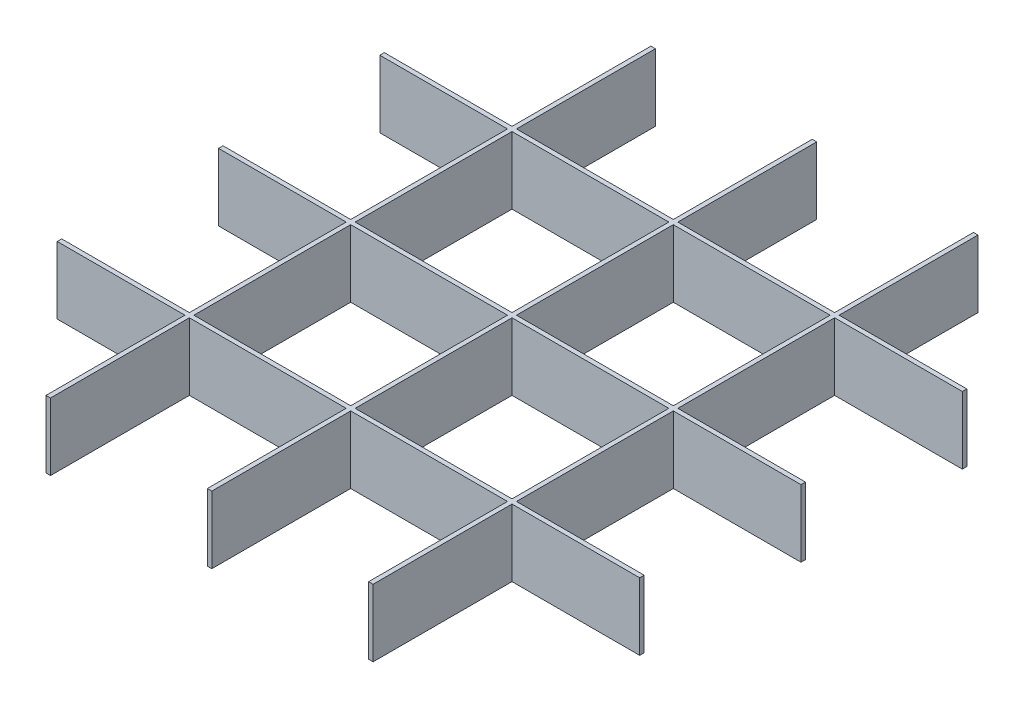
from build123d import *

# Parameters (mm, degrees)
SKETCH_1_W      = 70
SKETCH_1_H      = 70
EXTRUDE_2_DEPTH = 30


with BuildPart() as part:
    # 草图1 → 凸台-拉伸2 (new body)
    with BuildSketch(Plane(origin=(0, 0, 0), x_dir=(1, 0, 0), z_dir=(0, 1, 0))):
        Polygon((-71, 73), (-1, 73), (-1, 135), (1, 135), (1, 73), (71, 73), (71, 135), (73, 135), (73, 73), (130, 73), (130, 71), (73, 71), (73, 1), (130, 1), (130, -1), (73, -1), (73, -71), (130, -71), (130, -73), (73, -73), (73, -135), (71, -135), (71, -73), (1, -73), (1, -135), (-1, -135), (-1, -73), (-71, -73), (-71, -135), (-73, -135), (-73, -73), (-130, -73), (-130, -71), (-73, -71), (-73, -1), (-130, -1), (-130, 1), (-73, 1), (-73, 71), (-130, 71), (-130, 73), (-73, 73), (-73, 135), (-71, 135), align=None)
        with Locations((-36, 36)):
            Rectangle(SKETCH_1_W, SKETCH_1_H, mode=Mode.SUBTRACT)
        with Locations((-36, -36)):
            Rectangle(SKETCH_1_W, SKETCH_1_H, mode=Mode.SUBTRACT)
        with Locations((36, -36)):
            Rectangle(SKETCH_1_W, SKETCH_1_H, mode=Mode.SUBTRACT)
        with Locations((36, 36)):
            Rectangle(SKETCH_1_W, SKETCH_1_H, mode=Mode.SUBTRACT)
    extrude(amount=EXTRUDE_2_DEPTH)


solid = part.part
